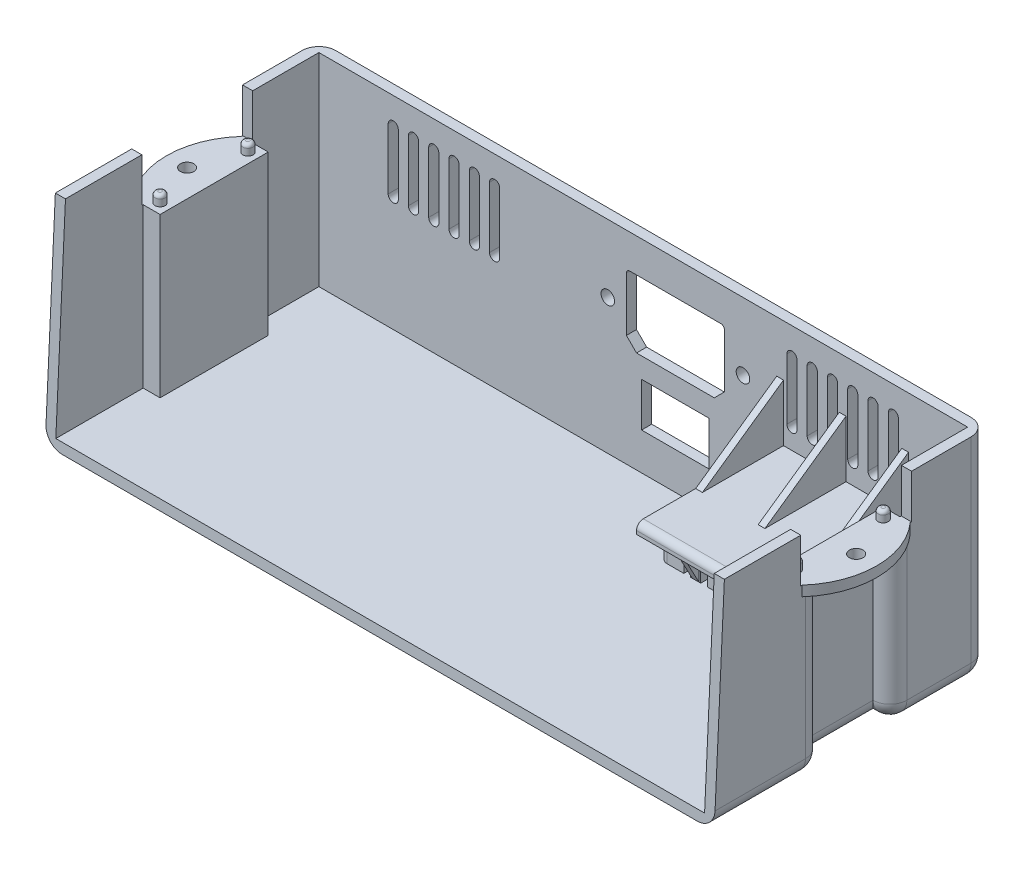
from build123d import *

# Parameters (mm, degrees)
SALIENTE_EXTRUIR1_DEPTH = 3
SALIENTE_EXTRUIR2_DEPTH = 60
CORTAR_EXTRUIR2_REACH   = 213.983
CORTAR_EXTRUIR3_DEPTH   = 16
SALIENTE_EXTRUIR3_DEPTH = 3
CROQUIS9_R              = 2
CORTAR_EXTRUIR4_DEPTH   = 3
REDONDEO1_R             = 5
CROQUIS10_R             = 1.5
SALIENTE_EXTRUIR4_DEPTH = 3
REDONDEO3_R             = 1
CORTAR_EXTRUIR5_DEPTH   = 3
CROQUIS13_R             = 2
CROQUIS13_W             = 20
CROQUIS13_H             = 13
CORTAR_EXTRUIR6_DEPTH   = 3
CORTAR_EXTRUIR7_DEPTH   = 1
CROQUIS16_W             = 39
CROQUIS16_H             = 3
SALIENTE_EXTRUIR5_DEPTH = 34.5
SALIENTE_EXTRUIR6_DEPTH = 10
NERVIO1_REACH           = 182.736
CROQUIS20_WALL_W        = 392.770968396
CROQUIS20_WALL_H        = 2
MATRIZL1_COUNT          = 2
MATRIZL1_PITCH          = 18.5
MATRIZL1_COL_COUNT      = 2
MATRIZL1_COL_PITCH      = 18.5
CORTAR_EXTRUIR8_DEPTH   = 3
CROQUIS22_R             = 5
CORTAR_EXTRUIR9_DEPTH   = 3
CROQUIS23_W             = 39
CROQUIS23_H             = 3
SALIENTE_EXTRUIR7_DEPTH = 7
NERVIO5_REACH           = 190.946
CROQUIS27_WALL_W        = 391.21762301
CROQUIS27_WALL_H        = 2
MATRIZL2_COUNT          = 2
MATRIZL2_PITCH          = 18
REDONDEO4_R             = 2
CROQUIS28_W             = 3
CROQUIS28_H             = 0.4
CORTAR_EXTRUIR10_DEPTH  = 13


with BuildPart() as part:
    # Croquis1 → Saliente-Extruir1 (new body)
    with BuildSketch(Plane(origin=(0, 0, 0), x_dir=(1, 0, 0), z_dir=(0, 1, 0))):
        Polygon((99, -10), (94, -10), (94, 10), (99, 10), (99, 39), (-99, 39), (-99, 10), (-94, 10), (-94, -10), (-99, -10), (-99, -42), (99, -42), align=None)
    extrude(amount=SALIENTE_EXTRUIR1_DEPTH)

    # Croquis2 → Saliente-Extruir2 (add)
    with BuildSketch(Plane(origin=(0, 3, 0), x_dir=(1, 0, 0), z_dir=(0, 1, 0))):
        Polygon((96, 36), (-96, 36), (-96, 16), (-91, 16), (-91, -16), (-96, -16), (-96, -42), (-99, -42), (-99, -10), (-94, -10), (-94, 10), (-99, 10), (-99, 39), (99, 39), (99, 10), (94, 10), (94, -10), (99, -10), (99, -42), (96, -42), (96, -16), (91, -16), (91, 16), (96, 16), align=None)
    extrude(amount=SALIENTE_EXTRUIR2_DEPTH)

    # Cortar-Extruir2: up to this face of the body (flat: up to its plane)
    cortar_extruir2_end = Plane(part.part.faces().sort_by_distance((-99, 31.5, 26))[0])
    # Croquis5 → Cortar-Extruir2 (cut, up to the picked face)
    with BuildSketch(Plane(origin=(99, 0, 0), x_dir=(0, 0, -1), z_dir=(1, 0, 0)), mode=Mode.PRIVATE) as cortar_extruir2_sk1:
        Polygon((-39, 63), (-42, 63), (-42, 0), align=None)
    cortar_extruir2_tool1 = split(extrude(cortar_extruir2_sk1.sketch, amount=-CORTAR_EXTRUIR2_REACH, mode=Mode.PRIVATE), bisect_by=cortar_extruir2_end, keep=Keep.BOTH, mode=Mode.PRIVATE)
    add(cortar_extruir2_tool1.solids().sort_by(Axis((99, 42, 41), (-1, 0, 0)))[0], mode=Mode.SUBTRACT)

    # Croquis7 → Cortar-Extruir3 (cut)
    with BuildSketch(Plane(origin=(0, 63, 0), x_dir=(1, 0, 0), z_dir=(0, 1, 0))):
        Polygon((-91, -16), (-99, -16), (-99, -10), (-94, -10), (-94, 10), (-99, 10), (-99, 16), (-91, 16), align=None)
        Polygon((91, 16), (99, 16), (99, 10), (94, 10), (94, -10), (99, -10), (99, -16), (91, -16), align=None)
    extrude(amount=-CORTAR_EXTRUIR3_DEPTH, mode=Mode.SUBTRACT)

    # Croquis8 → Saliente-Extruir3 (add)
    with BuildSketch(Plane(origin=(0, 47, 0), x_dir=(1, 0, 0), z_dir=(0, 1, 0))):
        with BuildLine():
            Line((-99, -16), (-91, -16))
            Line((-91, -16), (-91, 16))
            Line((-91, 16), (-99, 16))
            ThreePointArc((-99, 16), (-105.11145618, 0), (-99, -16))
        make_face()
        with BuildLine():
            Line((99, -16), (91, -16))
            Line((91, -16), (91, 16))
            Line((91, 16), (99, 16))
            ThreePointArc((99, 16), (105.11145618, 0), (99, -16))
        make_face()
    extrude(amount=SALIENTE_EXTRUIR3_DEPTH)

    # Croquis9 → Cortar-Extruir4 (cut)
    with BuildSketch(Plane(origin=(0, 50, 0), x_dir=(1, 0, 0), z_dir=(0, 1, 0))):
        with Locations(Location((-99, 0, 0), (0, 0, 270))):
            Circle(CROQUIS9_R)
        with Locations(Location((99, 0, 0), (0, 0, 270))):
            Circle(CROQUIS9_R)
    extrude(amount=-CORTAR_EXTRUIR4_DEPTH, mode=Mode.SUBTRACT)

    # Redondeo1
    redondeo1_edges = [part.edges().sort_by_distance(p)[0] for p in [
        (-99, 0, -24.5),
        (99, 0, -24.5),
        (-99, 31.5, -39),
        (99, 31.5, -39),
        (0, 0, -39),
        (99, 0, 26),
        (96.5, 0, 10),
        (94, 0, 0),
        (96.5, 0, -10),
        (-96.5, 0, -10),
        (-94, 0, 0),
        (-96.5, 0, 10),
        (-99, 0, 26),
        (99, 23.5, 10),
        (99, 23.5, -10),
        (-99, 23.5, 10),
        (-99, 23.5, -10),
    ]]
    fillet(redondeo1_edges, radius=REDONDEO1_R - 0.0001)  # a hair under: the kernel refuses the full size

    # Croquis10 → Saliente-Extruir4 (add)
    with BuildSketch(Plane(origin=(0, 50, 0), x_dir=(1, 0, 0), z_dir=(0, 1, 0))):
        with Locations(Location((94, 13, 0), (0, 0, 270))):
            Circle(CROQUIS10_R)
        with Locations(Location((94, -13, 0), (0, 0, 270))):
            Circle(CROQUIS10_R)
        with Locations(Location((-94, 13, 0), (0, 0, 90))):
            Circle(CROQUIS10_R)
        with Locations(Location((-94, -13, 0), (0, 0, 90))):
            Circle(CROQUIS10_R)
    extrude(amount=SALIENTE_EXTRUIR4_DEPTH)

    # Redondeo3
    redondeo3_edges = [part.edges().sort_by_distance(p)[0] for p in [
        (94, 53, -14.5),
        (94, 53, 11.5),
        (-94, 53, -11.5),
        (-94, 53, 14.5),
    ]]
    fillet(redondeo3_edges, radius=REDONDEO3_R)

    # Croquis11 → Cortar-Extruir5 (cut)
    with BuildSketch(Plane(origin=(0, 0, -39), x_dir=(-1, 0, 0), z_dir=(0, 0, -1))):
        with BuildLine():
            Line((-72.5, 37), (-72.5, 55))
            ThreePointArc((-72.5, 55), (-74, 56.5), (-75.5, 55))
            Line((-75.5, 55), (-75.5, 37))
            ThreePointArc((-75.5, 37), (-74, 35.5), (-72.5, 37))
        make_face()
        with BuildLine():
            Line((-69.5, 37), (-69.5, 55))
            ThreePointArc((-69.5, 55), (-68, 56.5), (-66.5, 55))
            Line((-66.5, 55), (-66.5, 37))
            ThreePointArc((-66.5, 37), (-68, 35.5), (-69.5, 37))
        make_face()
        with BuildLine():
            Line((-63.5, 37), (-63.5, 55))
            ThreePointArc((-63.5, 55), (-62, 56.5), (-60.5, 55))
            Line((-60.5, 55), (-60.5, 37))
            ThreePointArc((-60.5, 37), (-62, 35.5), (-63.5, 37))
        make_face()
        with BuildLine():
            Line((-57.5, 37), (-57.5, 55))
            ThreePointArc((-57.5, 55), (-56, 56.5), (-54.5, 55))
            Line((-54.5, 55), (-54.5, 37))
            ThreePointArc((-54.5, 37), (-56, 35.5), (-57.5, 37))
        make_face()
        with BuildLine():
            Line((-51.5, 37), (-51.5, 55))
            ThreePointArc((-51.5, 55), (-50, 56.5), (-48.5, 55))
            Line((-48.5, 55), (-48.5, 37))
            ThreePointArc((-48.5, 37), (-50, 35.5), (-51.5, 37))
        make_face()
        with BuildLine():
            Line((-45.5, 37), (-45.5, 55))
            ThreePointArc((-45.5, 55), (-44, 56.5), (-42.5, 55))
            Line((-42.5, 55), (-42.5, 37))
            ThreePointArc((-42.5, 37), (-44, 35.5), (-45.5, 37))
        make_face()
        with BuildLine():
            Line((42.5, 37), (42.5, 55))
            ThreePointArc((42.5, 55), (44, 56.5), (45.5, 55))
            Line((45.5, 55), (45.5, 37))
            ThreePointArc((45.5, 37), (44, 35.5), (42.5, 37))
        make_face()
        with BuildLine():
            Line((48.5, 37), (48.5, 55))
            ThreePointArc((48.5, 55), (50, 56.5), (51.5, 55))
            Line((51.5, 55), (51.5, 37))
            ThreePointArc((51.5, 37), (50, 35.5), (48.5, 37))
        make_face()
        with BuildLine():
            Line((54.5, 37), (54.5, 55))
            ThreePointArc((54.5, 55), (56, 56.5), (57.5, 55))
            Line((57.5, 55), (57.5, 37))
            ThreePointArc((57.5, 37), (56, 35.5), (54.5, 37))
        make_face()
        with BuildLine():
            Line((60.5, 37), (60.5, 55))
            ThreePointArc((60.5, 55), (62, 56.5), (63.5, 55))
            Line((63.5, 55), (63.5, 37))
            ThreePointArc((63.5, 37), (62, 35.5), (60.5, 37))
        make_face()
        with BuildLine():
            Line((66.5, 37), (66.5, 55))
            ThreePointArc((66.5, 55), (68, 56.5), (69.5, 55))
            Line((69.5, 55), (69.5, 37))
            ThreePointArc((69.5, 37), (68, 35.5), (66.5, 37))
        make_face()
        with BuildLine():
            Line((72.5, 37), (72.5, 55))
            ThreePointArc((72.5, 55), (74, 56.5), (75.5, 55))
            Line((75.5, 55), (75.5, 37))
            ThreePointArc((75.5, 37), (74, 35.5), (72.5, 37))
        make_face()
    extrude(amount=-CORTAR_EXTRUIR5_DEPTH, mode=Mode.SUBTRACT)

    # Croquis13 → Cortar-Extruir6 (cut)
    with BuildSketch(Plane(origin=(0, 0, -39), x_dir=(-1, 0, 0), z_dir=(0, 0, -1))):
        with Locations((-29.5, 43)):
            Circle(CROQUIS13_R)
        with Locations((10.5, 43)):
            Circle(CROQUIS13_R)
        with BuildLine():
            Line((4, 53), (-23, 53))
            ThreePointArc((-23, 53), (-23.707106781, 52.707106781), (-24, 52))
            Line((-24, 52), (-24, 36))
            Line((-24, 36), (-21, 33))
            Line((-21, 33), (2, 33))
            Line((2, 33), (5, 36))
            Line((5, 36), (5, 52))
            ThreePointArc((5, 52), (4.707106781, 52.707106781), (4, 53))
        make_face()
        with Locations((-9.5, 20.5)):
            Rectangle(CROQUIS13_W, CROQUIS13_H)
    extrude(amount=-CORTAR_EXTRUIR6_DEPTH, mode=Mode.SUBTRACT)

    # Croquis15 → Cortar-Extruir7 (cut)
    # profile 1 of 7: a face of its own
    with BuildSketch(Plane(origin=(0, 0, -39), x_dir=(-1, 0, 0), z_dir=(0, 0, -1))):
        with BuildLine():
            Line((24.072596154, 14.795833333), (23.330575588, 14.795833333))
            add(Edge.make_bspline(
                [(23.330575588, 14.795833333), (23.282092926, 14.796050352), (23.18855971, 14.796469026), (23.053677121, 14.801546017), (22.929241311, 14.810644269), (22.815280945, 14.821888345), (22.711842635, 14.837651846), (22.618797636, 14.855724247), (22.5361241, 14.877739148), (22.462897927, 14.903878631), (22.397159534, 14.934669103), (22.335022906, 14.967556737), (22.277423242, 15.006539935), (22.223008267, 15.048808712), (22.172189602, 15.095242433), (22.124590671, 15.145657582), (22.080701611, 15.200786837), (22.040797578, 15.260250407), (22.004578583, 15.322837655), (21.97294051, 15.388691308), (21.947276135, 15.457907185), (21.925747292, 15.530039805), (21.908455015, 15.605085401), (21.896944749, 15.683505684), (21.889126391, 15.764753045), (21.888436529, 15.820050052), (21.888087607, 15.848018496)],
                knots=[0, 0, 0, 0, 1.698787518, 3.27731721, 4.728409951, 6.070286353, 7.288646904, 8.393455548, 9.389990496, 10.283725379, 11.113616976, 11.931887102, 12.744353494, 13.547053751, 14.344590688, 15.153907614, 15.974148981, 16.810666655, 17.660988447, 18.506082349, 19.367288142, 20.244738011, 21.142497992, 22.06302001, 23.020302899, 24, 24, 24, 24], degree=3))
            add(Edge.make_bspline(
                [(21.888087607, 15.848018496), (21.888590265, 15.878960217), (21.889578051, 15.939764499), (21.899334696, 16.02888084), (21.915837522, 16.113903034), (21.937930185, 16.195194295), (21.966746985, 16.272576783), (22.00286408, 16.345542157), (22.044177089, 16.415004726), (22.09294874, 16.479694014), (22.146841569, 16.539939317), (22.204871828, 16.596396256), (22.268780741, 16.646744346), (22.336287201, 16.693601122), (22.409322758, 16.734216285), (22.485723508, 16.771824232), (22.567427191, 16.803738021), (22.624284426, 16.820481042), (22.653110811, 16.828969685)],
                knots=[0, 0, 0, 0, 1.101767505, 2.165108537, 3.187936629, 4.183892551, 5.162396277, 6.123736501, 7.080098904, 8.036826416, 9.0040019, 9.957275584, 10.916231297, 11.898534744, 12.880877694, 13.889532316, 14.930001539, 16, 16, 16, 16], degree=3))
            add(Edge.make_bspline(
                [(22.653110811, 16.828969685), (22.672099661, 16.833694142), (22.713235626, 16.843928836), (22.781304349, 16.85431962), (22.859746406, 16.863873307), (22.948815451, 16.872083544), (23.048562833, 16.877664593), (23.158891973, 16.882023143), (23.279852869, 16.885192259), (23.363964293, 16.885304714), (23.407745726, 16.885363248)],
                knots=[0, 0, 0, 0, 0.618981996, 1.340914327, 2.176866532, 3.120127938, 4.170906482, 5.338178032, 6.614476169, 8, 8, 8, 8], degree=3))
            Line((23.407745726, 16.885363248), (23.407745726, 18.5))
            Line((23.407745726, 18.5), (24.072596154, 18.5))
            Line((24.072596154, 18.5), (24.072596154, 14.795833333))
        make_face()
        with BuildLine():
            Line((23.407745726, 16.220512821), (23.172525207, 16.220512821))
            add(Edge.make_bspline(
                [(23.172525207, 16.220512821), (23.12972242, 16.220242432), (23.050964657, 16.219744914), (22.94341908, 16.212512136), (22.856965041, 16.201515476), (22.788739746, 16.185614984), (22.73484863, 16.16193911), (22.688927819, 16.13338355), (22.648130047, 16.099068868), (22.614121899, 16.05793091), (22.586408545, 16.012034042), (22.566970724, 15.961031703), (22.554702405, 15.905738963), (22.553537237, 15.867131072), (22.552938034, 15.847276476)],
                knots=[0, 0, 0, 0, 1.862351722, 3.426754836, 4.68713255, 5.653025869, 6.462861518, 7.236406327, 7.999926698, 8.771672214, 9.54880311, 10.322347919, 11.137246204, 12, 12, 12, 12], degree=3))
            add(Edge.make_bspline(
                [(22.552938034, 15.847276476), (22.553518551, 15.829925436), (22.554644894, 15.796260247), (22.563033347, 15.747707203), (22.576052655, 15.70253452), (22.595950142, 15.661371895), (22.620107504, 15.623259245), (22.650754122, 15.589383027), (22.686095972, 15.558647231), (22.713427278, 15.542398776), (22.727312867, 15.534143797)],
                knots=[0, 0, 0, 0, 1.102449765, 2.139017612, 3.12397484, 4.080535277, 5.035673127, 5.982361139, 6.974944601, 8, 8, 8, 8], degree=3))
            add(Edge.make_bspline(
                [(22.727312867, 15.534143797), (22.73907179, 15.528196972), (22.76396784, 15.515606326), (22.806368227, 15.500968779), (22.855297626, 15.488620396), (22.911086365, 15.478371357), (22.973511888, 15.470417038), (23.042563056, 15.464333974), (23.118341485, 15.461887737), (23.171040849, 15.461096155), (23.198495927, 15.460683761)],
                knots=[0, 0, 0, 0, 0.656809284, 1.390599849, 2.23162475, 3.173112763, 4.218524733, 5.370385145, 6.63003504, 8, 8, 8, 8], degree=3))
            Line((23.198495927, 15.460683761), (23.407745726, 15.460683761))
            Line((23.407745726, 15.460683761), (23.407745726, 16.220512821))
        make_face(mode=Mode.SUBTRACT)
    # profile 2 of 7: a face of its own
    with BuildSketch(Plane(origin=(0, 0, -39), x_dir=(-1, 0, 0), z_dir=(0, 0, -1))):
        with BuildLine():
            add(Edge.make_bspline(
                [(19.135784923, 14.700854701), (19.071383124, 14.7025215), (18.944239387, 14.70581214), (18.757262397, 14.733262876), (18.577053885, 14.777938435), (18.403588021, 14.84029832), (18.237456407, 14.921059965), (18.078048633, 15.019120307), (17.925801541, 15.135311428), (17.782490178, 15.267975277), (17.651077167, 15.413039044), (17.535563637, 15.567697919), (17.437507292, 15.730355113), (17.35791472, 15.901042318), (17.295758661, 16.079525077), (17.252560931, 16.265871126), (17.224708059, 16.459841838), (17.221512101, 16.591920622), (17.219887821, 16.659046975)],
                knots=[0, 0, 0, 0, 1.014151002, 2.002163778, 2.969868608, 3.93493411, 4.9003771, 5.874719092, 6.87846472, 7.912488755, 8.947011879, 9.957751389, 10.948740761, 11.933621513, 12.919426746, 13.920294397, 14.943031967, 16, 16, 16, 16], degree=3))
            add(Edge.make_bspline(
                [(17.219887821, 16.659046975), (17.221618155, 16.725416842), (17.225027836, 16.856200793), (17.251420487, 17.048385808), (17.295369006, 17.232729014), (17.35632677, 17.409293431), (17.43452765, 17.578081953), (17.531086485, 17.738546881), (17.64536888, 17.891017923), (17.775040371, 18.034560981), (17.916916711, 18.165702883), (18.068083387, 18.280829365), (18.227135982, 18.377661363), (18.393058283, 18.458033999), (18.56741558, 18.518431748), (18.748274787, 18.563639643), (18.937148842, 18.589781337), (19.065461651, 18.593228777), (19.130590779, 18.594978632)],
                knots=[0, 0, 0, 0, 1.051517626, 2.07204922, 3.067438659, 4.05042616, 5.027204762, 6.009981242, 7.012629434, 8.042243656, 9.071350414, 10.070091277, 11.048190212, 12.017682766, 12.985867053, 13.966945899, 14.968060614, 16, 16, 16, 16], degree=3))
            add(Edge.make_bspline(
                [(19.130590779, 18.594978632), (19.198713309, 18.593427328), (19.332564771, 18.590379227), (19.528505609, 18.5616377), (19.71596631, 18.517817413), (19.894433227, 18.454376183), (20.063767621, 18.371943136), (20.224728886, 18.272411522), (20.37610645, 18.153858753), (20.517395727, 18.01986058), (20.645389244, 17.873199164), (20.758372525, 17.718274251), (20.853675451, 17.556257448), (20.931302916, 17.387076021), (20.992501228, 17.211780584), (21.035669699, 17.029303752), (21.061170341, 16.840083112), (21.064722433, 16.711560673), (21.066522436, 16.646432626)],
                knots=[0, 0, 0, 0, 1.067953136, 2.098381936, 3.099641766, 4.083805132, 5.062469929, 6.048665414, 7.046702845, 8.073106546, 9.098695993, 10.09591865, 11.076726721, 12.041940862, 13.011263376, 13.984305721, 14.978557872, 16, 16, 16, 16], degree=3))
            add(Edge.make_bspline(
                [(21.066522436, 16.646432626), (21.065949697, 16.602619784), (21.064811471, 16.515548872), (21.051401393, 16.386480732), (21.031512608, 16.260116825), (21.004285338, 16.136219526), (20.967601153, 16.015108128), (20.923014504, 15.896477133), (20.871057006, 15.780327197), (20.811140976, 15.667708732), (20.743363991, 15.559969157), (20.670996459, 15.456167469), (20.591266549, 15.359028667), (20.505819923, 15.267497585), (20.414321892, 15.181992632), (20.316613104, 15.102221845), (20.212847349, 15.028388685), (20.104146994, 14.959883035), (19.990883876, 14.89988273), (19.875752737, 14.845496846), (19.757648334, 14.801400786), (19.637428184, 14.76487904), (19.515368683, 14.735568856), (19.390527425, 14.716080083), (19.263958043, 14.702564064), (19.178610689, 14.701425841), (19.135784923, 14.700854701)],
                knots=[0, 0, 0, 0, 1.034641744, 2.056182551, 3.061960284, 4.05571729, 5.050247014, 6.048716841, 7.047801973, 8.054190544, 9.059424999, 10.053182006, 11.041513076, 12.025412457, 13.009311837, 13.997642908, 15.002928308, 16.016213968, 17.030509951, 18.02913364, 19.022134519, 20.005478534, 20.996155877, 21.984625117, 22.988721131, 24, 24, 24, 24], degree=3))
        make_face()
        with BuildLine():
            add(Edge.make_bspline(
                [(19.14617321, 15.365705128), (19.189515394, 15.366868098), (19.27505552, 15.369163334), (19.400527343, 15.38664989), (19.520984587, 15.414578017), (19.635760155, 15.45503118), (19.745349105, 15.506519175), (19.849954648, 15.568855868), (19.948094298, 15.644207843), (20.041207484, 15.728439587), (20.125036265, 15.822680806), (20.200409693, 15.92257597), (20.26135217, 16.030528722), (20.313753999, 16.142983393), (20.352460855, 16.262783841), (20.38193209, 16.387985715), (20.397984071, 16.519874301), (20.400425182, 16.609539377), (20.401672009, 16.655336872)],
                knots=[0, 0, 0, 0, 1.033668485, 2.040047952, 3.016132939, 3.979056467, 4.937231767, 5.900589077, 6.877725736, 7.88429546, 8.891280164, 9.882584218, 10.863295226, 11.842887319, 12.837417301, 13.860812229, 14.907384602, 16, 16, 16, 16], degree=3))
            add(Edge.make_bspline(
                [(20.401672009, 16.655336872), (20.40015643, 16.706104933), (20.397186148, 16.805601921), (20.376590921, 16.950823252), (20.340504071, 17.087812597), (20.291205085, 17.21702823), (20.225672669, 17.337111377), (20.147294421, 17.449517842), (20.05410792, 17.553550203), (19.982443955, 17.614339235), (19.946071381, 17.645192308)],
                knots=[0, 0, 0, 0, 1.078343132, 2.113373867, 3.107373148, 4.082093053, 5.043582658, 6.005574554, 6.987742499, 8, 8, 8, 8], degree=3))
            add(Edge.make_bspline(
                [(19.946071381, 17.645192308), (19.916267361, 17.667981759), (19.857330811, 17.71304721), (19.763255246, 17.770807831), (19.666375938, 17.820314446), (19.565961812, 17.860315205), (19.462224937, 17.891779129), (19.355179538, 17.913812798), (19.24497729, 17.927640831), (19.170453366, 17.929293543), (19.13281684, 17.930128205)],
                knots=[0, 0, 0, 0, 1.023928204, 2.024787132, 3.009472467, 3.9914905, 4.972207045, 5.96565515, 6.972602802, 8, 8, 8, 8], degree=3))
            add(Edge.make_bspline(
                [(19.13281684, 17.930128205), (19.090220751, 17.928953711), (19.006411606, 17.926642856), (18.883263735, 17.909395332), (18.76533906, 17.880078555), (18.651544542, 17.840267434), (18.543403976, 17.786913637), (18.43923099, 17.723560095), (18.340267147, 17.648230947), (18.24771888, 17.561876493), (18.162903341, 17.467630829), (18.087865193, 17.367195343), (18.025721236, 17.260566127), (17.973885265, 17.149167517), (17.933499272, 17.032112547), (17.905860917, 16.909392388), (17.888098276, 16.78150216), (17.885872263, 16.694476752), (17.884738248, 16.650142728)],
                knots=[0, 0, 0, 0, 1.026350473, 2.019376834, 2.989435443, 3.95094063, 4.91865229, 5.889827372, 6.885283771, 7.910196595, 8.935871797, 9.9372888, 10.925850568, 11.904605667, 12.894245083, 13.903507864, 14.931967858, 16, 16, 16, 16], degree=3))
            add(Edge.make_bspline(
                [(17.884738248, 16.650142728), (17.885907107, 16.606061818), (17.888207828, 16.51929527), (17.905552007, 16.391759825), (17.934386116, 16.269713972), (17.975137926, 16.15284311), (18.025906202, 16.040533674), (18.089679609, 15.933760414), (18.165075826, 15.832615708), (18.250716546, 15.737700874), (18.343915874, 15.650474374), (18.443978707, 15.574779117), (18.548100387, 15.50900196), (18.658671227, 15.457474884), (18.773428714, 15.416423346), (18.893073193, 15.386192412), (19.0180578, 15.369286174), (19.103087413, 15.36690945), (19.14617321, 15.365705128)],
                knots=[0, 0, 0, 0, 1.055040155, 2.076685641, 3.074845078, 4.052329834, 5.035358467, 6.020382375, 7.023447318, 8.050688466, 9.077178457, 10.074336316, 11.0503314, 12.019748348, 12.988025369, 13.964577102, 14.968620271, 16, 16, 16, 16], degree=3))
        make_face(mode=Mode.SUBTRACT)
    # profile 3 of 7: a face of its own
    with BuildSketch(Plane(origin=(0, 0, -39), x_dir=(-1, 0, 0), z_dir=(0, 0, -1))):
        Polygon((16.564535256, 14.795833333), (15.878166233, 14.795833333), (15.329813034, 17.160652878), (14.701321615, 14.795833333), (14.055021701, 14.795833333), (13.430240385, 17.160652878), (12.883371227, 14.795833333), (12.195518162, 14.795833333), (13.052551916, 18.5), (13.747083166, 18.5), (14.380026709, 16.105499633), (15.016680355, 18.5), (15.706017461, 18.5), align=None)
    # profile 4 of 7: a face of its own
    with BuildSketch(Plane(origin=(0, 0, -39), x_dir=(-1, 0, 0), z_dir=(0, 0, -1))):
        Polygon((11.255229701, 14.795833333), (9.260678419, 14.795833333), (9.260678419, 15.460683761), (10.590379274, 15.460683761), (10.590379274, 16.173023504), (9.260678419, 16.173023504), (9.260678419, 16.837873932), (10.590379274, 16.837873932), (10.590379274, 17.835149573), (9.260678419, 17.835149573), (9.260678419, 18.5), (11.255229701, 18.5), align=None)
    # profile 5 of 7: a face of its own
    with BuildSketch(Plane(origin=(0, 0, -39), x_dir=(-1, 0, 0), z_dir=(0, 0, -1))):
        with BuildLine():
            Line((8.249155983, 14.795833333), (7.474486512, 14.795833333))
            add(Edge.make_bspline(
                [(7.474486512, 14.795833333), (7.42328064, 14.796011867), (7.324797325, 14.796355237), (7.182797056, 14.801912881), (7.052324497, 14.809444603), (6.933089779, 14.821644593), (6.825228792, 14.835663398), (6.728961491, 14.854482701), (6.643929847, 14.875359574), (6.569087866, 14.901049653), (6.501710971, 14.930587524), (6.439152962, 14.96402608), (6.379850823, 15.002275301), (6.324236372, 15.045212391), (6.27059819, 15.09120668), (6.221808016, 15.142931337), (6.175689296, 15.198693412), (6.132726428, 15.258496515), (6.094151923, 15.322201049), (6.060889156, 15.38904544), (6.032248913, 15.458624213), (6.009583041, 15.531191605), (5.991506877, 15.606541028), (5.979419184, 15.684485534), (5.97043806, 15.765199384), (5.969928656, 15.820042454), (5.969668803, 15.848018496)],
                knots=[0, 0, 0, 0, 1.748592178, 3.36303531, 4.852592433, 6.210838904, 7.455605234, 8.565530618, 9.559147328, 10.443333557, 11.264119507, 12.069061813, 12.863340979, 13.67089394, 14.467102114, 15.273638367, 16.095597024, 16.937114566, 17.786018611, 18.63597263, 19.484582448, 20.352808207, 21.22970172, 22.128176732, 23.04516274, 24, 24, 24, 24], degree=3))
            add(Edge.make_bspline(
                [(5.969668803, 15.848018496), (5.970352758, 15.877217536), (5.971693869, 15.93447153), (5.978857933, 16.018584031), (5.992176768, 16.099252104), (6.011692699, 16.175958068), (6.035052121, 16.249487527), (6.065304824, 16.318692874), (6.099706805, 16.384798343), (6.140518712, 16.446714578), (6.185335993, 16.505772177), (6.237385954, 16.55982619), (6.293727563, 16.611438998), (6.356075331, 16.658853002), (6.424242596, 16.701773041), (6.496947541, 16.741942466), (6.575194947, 16.778647801), (6.630157539, 16.79917838), (6.658263889, 16.80967715)],
                knots=[0, 0, 0, 0, 1.099808295, 2.156523617, 3.176426857, 4.17500812, 5.135317955, 6.078349783, 7.015890908, 7.9382699, 8.868004242, 9.803692517, 10.759882289, 11.743580734, 12.748787378, 13.791075452, 14.870417076, 16, 16, 16, 16], degree=3))
            Line((6.658263889, 16.80967715), (5.803456197, 18.5))
            Line((5.803456197, 18.5), (6.542508681, 18.5))
            Line((6.542508681, 18.5), (7.358731303, 16.885363248))
            Line((7.358731303, 16.885363248), (7.584305556, 16.885363248))
            Line((7.584305556, 16.885363248), (7.584305556, 18.5))
            Line((7.584305556, 18.5), (8.249155983, 18.5))
            Line((8.249155983, 18.5), (8.249155983, 14.795833333))
        make_face()
        with BuildLine():
            Line((7.584305556, 16.220512821), (7.325340378, 16.220512821))
            add(Edge.make_bspline(
                [(7.325340378, 16.220512821), (7.293679727, 16.220156242), (7.233056384, 16.219473471), (7.145872135, 16.216306384), (7.066687763, 16.208675655), (6.995164443, 16.199033507), (6.930938359, 16.18790341), (6.874594868, 16.171942583), (6.825226171, 16.154871307), (6.783541102, 16.133554455), (6.747780999, 16.109738863), (6.717806727, 16.081490051), (6.691400473, 16.050544976), (6.670687178, 16.014955939), (6.653952171, 15.976181016), (6.643573659, 15.933490695), (6.635339294, 15.887657934), (6.634799913, 15.855729256), (6.634519231, 15.839114249)],
                knots=[0, 0, 0, 0, 1.688935225, 3.233948049, 4.651771667, 5.929878493, 7.083962697, 8.124219224, 9.050753627, 9.864999381, 10.615157594, 11.334035464, 12.05533055, 12.777108108, 13.522027315, 14.29964284, 15.115170198, 16, 16, 16, 16], degree=3))
            add(Edge.make_bspline(
                [(6.634519231, 15.839114249), (6.635236449, 15.819472089), (6.636636528, 15.781128735), (6.651775321, 15.725772923), (6.674617861, 15.674164661), (6.706956026, 15.62701881), (6.747299306, 15.585769002), (6.793531416, 15.549625168), (6.846538855, 15.520696416), (6.89548368, 15.500966056), (6.94074726, 15.489593566), (6.981324244, 15.481458833), (7.028401067, 15.474868818), (7.081910775, 15.470018858), (7.141755038, 15.465404027), (7.208075871, 15.462546949), (7.280814011, 15.461272058), (7.33152349, 15.460885506), (7.357989283, 15.460683761)],
                knots=[0, 0, 0, 0, 1.020050218, 1.991234449, 2.965145773, 3.94719294, 4.948794399, 5.958308566, 6.989992871, 8.082620171, 8.694688219, 9.416833949, 10.236190632, 11.167557654, 12.21328564, 13.36031274, 14.622320386, 16, 16, 16, 16], degree=3))
            Line((7.357989283, 15.460683761), (7.584305556, 15.460683761))
            Line((7.584305556, 15.460683761), (7.584305556, 16.220512821))
        make_face(mode=Mode.SUBTRACT)
    # profile 6 of 7: a face of its own
    with BuildSketch(Plane(origin=(0, 0, -39), x_dir=(-1, 0, 0), z_dir=(0, 0, -1))):
        with BuildLine():
            add(Edge.make_bspline(
                [(16.565488448, 21.921955128), (16.50108665, 21.923621928), (16.373942913, 21.926912568), (16.186965922, 21.954363303), (16.006757411, 21.999038862), (15.833291547, 22.061398748), (15.667159933, 22.142160392), (15.507752159, 22.240220734), (15.355505067, 22.356411855), (15.212193704, 22.489075704), (15.080780692, 22.634139472), (14.965267162, 22.788798347), (14.867210817, 22.951455541), (14.787618245, 23.122142746), (14.725462186, 23.300625505), (14.682264457, 23.486971553), (14.654411585, 23.680942266), (14.651215627, 23.813021049), (14.649591346, 23.880147403)],
                knots=[0, 0, 0, 0, 1.014151002, 2.002163778, 2.969868608, 3.93493411, 4.9003771, 5.874719092, 6.87846472, 7.912488755, 8.947011879, 9.957751389, 10.948740761, 11.933621513, 12.919426746, 13.920294397, 14.943031967, 16, 16, 16, 16], degree=3))
            add(Edge.make_bspline(
                [(14.649591346, 23.880147403), (14.651321681, 23.946517269), (14.654731361, 24.07730122), (14.681124012, 24.269486236), (14.725072532, 24.453829441), (14.786030296, 24.630393858), (14.864231176, 24.79918238), (14.960790011, 24.959647309), (15.075072406, 25.11211835), (15.204743897, 25.255661408), (15.346620237, 25.386803311), (15.497786913, 25.501929792), (15.656839507, 25.59876179), (15.822761809, 25.679134426), (15.997119106, 25.739532176), (16.177978313, 25.78474007), (16.366852368, 25.810881764), (16.495165176, 25.814329205), (16.560294304, 25.81607906)],
                knots=[0, 0, 0, 0, 1.051517626, 2.07204922, 3.067438659, 4.05042616, 5.027204762, 6.009981242, 7.012629434, 8.042243656, 9.071350414, 10.070091277, 11.048190212, 12.017682766, 12.985867053, 13.966945899, 14.968060614, 16, 16, 16, 16], degree=3))
            add(Edge.make_bspline(
                [(16.560294304, 25.81607906), (16.628416835, 25.814527756), (16.762268296, 25.811479655), (16.958209135, 25.782738127), (17.145669836, 25.738917841), (17.324136752, 25.67547661), (17.493471147, 25.593043563), (17.654432412, 25.49351195), (17.805809976, 25.37495918), (17.947099253, 25.240961007), (18.075092769, 25.094299591), (18.188076051, 24.939374679), (18.283378976, 24.777357875), (18.361006442, 24.608176448), (18.422204753, 24.432881011), (18.465373224, 24.250404179), (18.490873867, 24.06118354), (18.494425958, 23.932661101), (18.496225962, 23.867533053)],
                knots=[0, 0, 0, 0, 1.067953136, 2.098381936, 3.099641766, 4.083805132, 5.062469929, 6.048665414, 7.046702845, 8.073106546, 9.098695993, 10.09591865, 11.076726721, 12.041940862, 13.011263376, 13.984305721, 14.978557872, 16, 16, 16, 16], degree=3))
            add(Edge.make_bspline(
                [(18.496225962, 23.867533053), (18.495653223, 23.823720211), (18.494514997, 23.7366493), (18.481104919, 23.60758116), (18.461216134, 23.481217252), (18.433988864, 23.357319954), (18.397304678, 23.236208555), (18.35271803, 23.11757756), (18.300760531, 23.001427624), (18.240844501, 22.888809159), (18.173067517, 22.781069585), (18.100699984, 22.677267897), (18.020970075, 22.580129095), (17.935523448, 22.488598012), (17.844025418, 22.403093059), (17.746316629, 22.323322272), (17.642550875, 22.249489113), (17.533850519, 22.180983463), (17.420587401, 22.120983157), (17.305456263, 22.066597273), (17.18735186, 22.022501213), (17.067131709, 21.985979468), (16.945072208, 21.956669284), (16.820230951, 21.93718051), (16.693661569, 21.923664491), (16.608314215, 21.922526268), (16.565488448, 21.921955128)],
                knots=[0, 0, 0, 0, 1.034641744, 2.056182551, 3.061960284, 4.05571729, 5.050247014, 6.048716841, 7.047801973, 8.054190544, 9.059424999, 10.053182006, 11.041513076, 12.025412457, 13.009311837, 13.997642908, 15.002928308, 16.016213968, 17.030509951, 18.02913364, 19.022134519, 20.005478534, 20.996155877, 21.984625117, 22.988721131, 24, 24, 24, 24], degree=3))
        make_face()
        with BuildLine():
            add(Edge.make_bspline(
                [(16.575876736, 22.586805556), (16.61921892, 22.587968525), (16.704759046, 22.590263762), (16.830230869, 22.607750318), (16.950688112, 22.635678445), (17.065463681, 22.676131607), (17.17505263, 22.727619602), (17.279658174, 22.789956296), (17.377797823, 22.865308271), (17.47091101, 22.949540014), (17.55473979, 23.043781234), (17.630113219, 23.143676397), (17.691055695, 23.25162915), (17.743457525, 23.364083821), (17.782164381, 23.483884269), (17.811635615, 23.609086142), (17.827687597, 23.740974728), (17.830128708, 23.830639804), (17.831375534, 23.8764373)],
                knots=[0, 0, 0, 0, 1.033668485, 2.040047952, 3.016132939, 3.979056467, 4.937231767, 5.900589077, 6.877725736, 7.88429546, 8.891280164, 9.882584218, 10.863295226, 11.842887319, 12.837417301, 13.860812229, 14.907384602, 16, 16, 16, 16], degree=3))
            add(Edge.make_bspline(
                [(17.831375534, 23.8764373), (17.829859956, 23.927205361), (17.826889673, 24.026702348), (17.806294447, 24.171923679), (17.770207596, 24.308913024), (17.72090861, 24.438128658), (17.655376195, 24.558211804), (17.576997947, 24.67061827), (17.483811446, 24.774650631), (17.41214748, 24.835439662), (17.375774907, 24.866292735)],
                knots=[0, 0, 0, 0, 1.078343132, 2.113373867, 3.107373148, 4.082093053, 5.043582658, 6.005574554, 6.987742499, 8, 8, 8, 8], degree=3))
            add(Edge.make_bspline(
                [(17.375774907, 24.866292735), (17.345970887, 24.889082186), (17.287034337, 24.934147638), (17.192958772, 24.991908259), (17.096079464, 25.041414873), (16.995665338, 25.081415632), (16.891928462, 25.112879556), (16.784883064, 25.134913225), (16.674680816, 25.148741258), (16.600156891, 25.15039397), (16.562520366, 25.151228632)],
                knots=[0, 0, 0, 0, 1.023928204, 2.024787132, 3.009472467, 3.9914905, 4.972207045, 5.96565515, 6.972602802, 8, 8, 8, 8], degree=3))
            add(Edge.make_bspline(
                [(16.562520366, 25.151228632), (16.519924277, 25.150054138), (16.436115132, 25.147743284), (16.312967261, 25.130495759), (16.195042586, 25.101178982), (16.081248068, 25.061367862), (15.973107501, 25.008014065), (15.868934515, 24.944660522), (15.769970673, 24.869331374), (15.677422406, 24.78297692), (15.592606867, 24.688731256), (15.517568718, 24.58829577), (15.455424761, 24.481666554), (15.403588791, 24.370267945), (15.363202798, 24.253212974), (15.335564443, 24.130492815), (15.317801802, 24.002602587), (15.315575789, 23.91557718), (15.314441774, 23.871243156)],
                knots=[0, 0, 0, 0, 1.026350473, 2.019376834, 2.989435443, 3.95094063, 4.91865229, 5.889827372, 6.885283771, 7.910196595, 8.935871797, 9.9372888, 10.925850568, 11.904605667, 12.894245083, 13.903507864, 14.931967858, 16, 16, 16, 16], degree=3))
            add(Edge.make_bspline(
                [(15.314441774, 23.871243156), (15.315610633, 23.827162246), (15.317911354, 23.740395697), (15.335255533, 23.612860252), (15.364089641, 23.4908144), (15.404841452, 23.373943537), (15.455609728, 23.261634101), (15.519383135, 23.154860841), (15.594779351, 23.053716135), (15.680420072, 22.958801301), (15.7736194, 22.871574801), (15.873682233, 22.795879545), (15.977803913, 22.730102387), (16.088374752, 22.678575311), (16.20313224, 22.637523774), (16.322776719, 22.607292839), (16.447761325, 22.590386601), (16.532790938, 22.588009878), (16.575876736, 22.586805556)],
                knots=[0, 0, 0, 0, 1.055040155, 2.076685641, 3.074845078, 4.052329834, 5.035358467, 6.020382375, 7.023447318, 8.050688466, 9.077178457, 10.074336316, 11.0503314, 12.019748348, 12.988025369, 13.964577102, 14.968620271, 16, 16, 16, 16], degree=3))
        make_face(mode=Mode.SUBTRACT)
    # profile 7 of 7: a face of its own
    with BuildSketch(Plane(origin=(0, 0, -39), x_dir=(-1, 0, 0), z_dir=(0, 0, -1))):
        Polygon((13.63806891, 22.016933761), (13.039258313, 22.016933761), (11.358581731, 24.454471321), (11.358581731, 22.016933761), (10.693731303, 22.016933761), (10.693731303, 25.721100427), (11.296994024, 25.721100427), (12.973218483, 23.290983073), (12.973218483, 25.721100427), (13.63806891, 25.721100427), align=None)
    extrude(amount=-CORTAR_EXTRUIR7_DEPTH, mode=Mode.SUBTRACT)

    # Croquis16 → Saliente-Extruir5 (add)
    with BuildSketch(Plane.XY.offset(-36)):
        with Locations((59, 29.5)):
            Rectangle(CROQUIS16_W, CROQUIS16_H)
    extrude(amount=SALIENTE_EXTRUIR5_DEPTH)

    # Croquis19 → Saliente-Extruir6 (add)
    with BuildSketch(Plane.XZ.offset(-28)):
        Polygon((61.5, -4.5), (74.5, -4.5), (74.5, -8.5), (75.5, -8.5), (75.5, -17.5), (78.5, -17.5), (78.5, -1.5), (39.5, -1.5), (39.5, -17.5), (42.5, -17.5), (42.5, -8.5), (43.5, -8.5), (43.5, -4.5), (56.5, -4.5), (56.5, -8.5), (57.5, -8.5), (57.5, -36), (60.5, -36), (60.5, -8.5), (61.5, -8.5), align=None)
    extrude(amount=SALIENTE_EXTRUIR6_DEPTH)

    # Croquis20 wall → Nervio1 (add, up to next)
    with BuildSketch(Plane(origin=(59, 39.402490458, -24), x_dir=(0, 0.57357643635, -0.81915204429), z_dir=(0, -0.81915204429, -0.57357643635)), mode=Mode.PRIVATE) as nervio1_sk1:
        Rectangle(CROQUIS20_WALL_W, CROQUIS20_WALL_H)
    nervio1_tool1 = extrude(nervio1_sk1.sketch, amount=NERVIO1_REACH, mode=Mode.PRIVATE) - part.part
    nervio1 = nervio1_tool1.solids().sort_by_distance((59, 39.402490458, -24))[0]
    add(nervio1)

    # MatrizL1: Nervio1 ×2
    with Locations(*[(-i * MATRIZL1_PITCH, 0, 0) for i in range(1, MATRIZL1_COUNT)]):
        add(nervio1)

    # MatrizL1 col: Nervio1 ×2
    with Locations(*[(i * MATRIZL1_COL_PITCH, 0, 0) for i in range(1, MATRIZL1_COL_COUNT)]):
        add(nervio1)

    # Croquis21 → Cortar-Extruir8 (cut)
    with BuildSketch(Plane.XY.offset(-1.5)):
        with BuildLine():
            Line((71.5, 18), (71.5, 24))
            ThreePointArc((71.5, 24), (70.5, 25), (69.5, 24))
            Line((69.5, 24), (69.5, 18))
            Line((69.5, 18), (71.5, 18))
        make_face()
        with BuildLine():
            Line((66.5, 18), (64.5, 18))
            Line((64.5, 18), (64.5, 24))
            ThreePointArc((64.5, 24), (65.5, 25), (66.5, 24))
            Line((66.5, 24), (66.5, 18))
        make_face()
        with BuildLine():
            Line((53.5, 18), (51.5, 18))
            Line((51.5, 18), (51.5, 24))
            ThreePointArc((51.5, 24), (52.5, 25), (53.5, 24))
            Line((53.5, 24), (53.5, 18))
        make_face()
        with BuildLine():
            Line((48.5, 18), (46.5, 18))
            Line((46.5, 18), (46.5, 24))
            ThreePointArc((46.5, 24), (47.5, 25), (48.5, 24))
            Line((48.5, 24), (48.5, 18))
        make_face()
    extrude(amount=-CORTAR_EXTRUIR8_DEPTH, mode=Mode.SUBTRACT)

    # Croquis22 → Cortar-Extruir9 (cut)
    with BuildSketch(Plane(origin=(0, 0, -39), x_dir=(-1, 0, 0), z_dir=(0, 0, -1))):
        with Locations((-50, 21.5)):
            Circle(CROQUIS22_R)
        with Locations((-68, 21.5)):
            Circle(CROQUIS22_R)
    extrude(amount=-CORTAR_EXTRUIR9_DEPTH, mode=Mode.SUBTRACT)

    # Croquis23 → Saliente-Extruir7 (add)
    with BuildSketch(Plane.XY.offset(-1.5)):
        with Locations((59, 29.5)):
            Rectangle(CROQUIS23_W, CROQUIS23_H)
    extrude(amount=SALIENTE_EXTRUIR7_DEPTH)

    # Croquis27 wall → Nervio5 (add, up to next)
    with BuildSketch(Plane(origin=(68, 23, 1.158547159), x_dir=(0, 0.882947592845, 0.469471562812), z_dir=(0, 0.469471562812, -0.882947592845)), mode=Mode.PRIVATE) as nervio5_sk1:
        Rectangle(CROQUIS27_WALL_W, CROQUIS27_WALL_H)
    nervio5_tool1 = extrude(nervio5_sk1.sketch, amount=NERVIO5_REACH, mode=Mode.PRIVATE) - part.part
    nervio5 = nervio5_tool1.solids().sort_by_distance((68, 23, 1.158547159))[0]
    add(nervio5)

    # MatrizL2: Nervio5 ×2
    with Locations(*[(-i * MATRIZL2_PITCH, 0, 0) for i in range(1, MATRIZL2_COUNT)]):
        add(nervio5)

    # Redondeo4
    redondeo4_edges = [part.edges().sort_by_distance(p)[0] for p in [
        (39.5, 23, -1.5),
        (59, 31, 5.5),
        (78.5, 23, -1.5),
    ]]
    fillet(redondeo4_edges, radius=REDONDEO4_R)

    # Croquis28 → Cortar-Extruir10 (cut)
    with BuildSketch(Plane(origin=(0, 63, 0), x_dir=(1, 0, 0), z_dir=(0, 1, 0))):
        with Locations((-97.5, 16.2)):
            Rectangle(CROQUIS28_W, CROQUIS28_H)
        with Locations((-97.5, -16.2)):
            Rectangle(CROQUIS28_W, CROQUIS28_H)
        with Locations((97.5, -16.2)):
            Rectangle(CROQUIS28_W, CROQUIS28_H)
        with Locations((97.5, 16.2)):
            Rectangle(CROQUIS28_W, CROQUIS28_H)
    extrude(amount=-CORTAR_EXTRUIR10_DEPTH, mode=Mode.SUBTRACT)


solid = part.part
